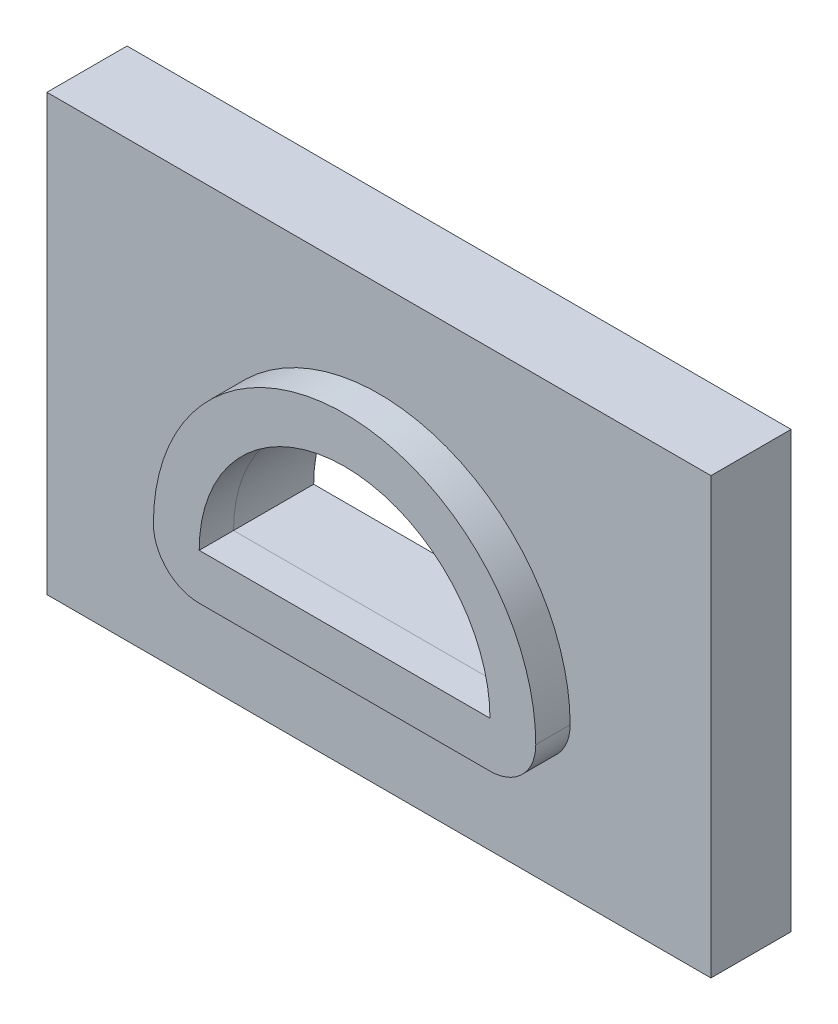
from build123d import *

# Parameters (mm, degrees)
CAP_ALIGNMENT_LIP_DEPTH = 1.5
SKETCH1_3_W             = 29
SKETCH1_3_H             = 19
CAP_BODY_DEPTH          = 3.5
LIP_CORNER_FILLET_R     = 2


with BuildPart() as part:
    # Sketch1 → cap alignment lip (new body)
    with BuildSketch(Plane.XY):
        with BuildLine():
            Line((10.5, -2), (10.5, 0))
            ThreePointArc((10.5, 0), (2.15, 8.35), (-6.2, 0))
            Line((-6.2, 0), (-6.2, -2))
            Line((-6.2, -2), (10.5, -2))
        make_face()
        with BuildLine():
            ThreePointArc((8.5, 0), (2.15, 6.35), (-4.2, 0))
            Line((-4.2, 0), (8.5, 0))
        make_face(mode=Mode.SUBTRACT)
    extrude(amount=CAP_ALIGNMENT_LIP_DEPTH)

    # lip corner fillet
    lip_corner_fillet_edges = [part.edges().sort_by_distance(p)[0] for p in [
        (-6.2, -2, 0.75),
        (10.5, -2, 0.75),
    ]]
    fillet(lip_corner_fillet_edges, radius=LIP_CORNER_FILLET_R - 0.0001)  # a hair under: the kernel refuses the full size


with BuildPart() as body_2:
    # Sketch1<3> → cap body (new body)
    # profile 1 of 2: a face of its own
    with BuildSketch(Plane.XY):
        with Locations((2.15, 3)):
            Rectangle(SKETCH1_3_W, SKETCH1_3_H)
        with BuildLine():
            ThreePointArc((10.5, 0), (2.15, 8.35), (-6.2, 0))
            Line((-6.2, 0), (-6.2, -2))
            Line((-6.2, -2), (10.5, -2))
            Line((10.5, -2), (10.5, 0))
        make_face(mode=Mode.SUBTRACT)
    # profile 2 of 2: a face of its own
    with BuildSketch(Plane.XY):
        with BuildLine():
            Line((10.5, -2), (10.5, 0))
            ThreePointArc((10.5, 0), (2.15, 8.35), (-6.2, 0))
            Line((-6.2, 0), (-6.2, -2))
            Line((-6.2, -2), (10.5, -2))
        make_face()
        with BuildLine():
            ThreePointArc((8.5, 0), (2.15, 6.35), (-4.2, 0))
            Line((-4.2, 0), (8.5, 0))
        make_face(mode=Mode.SUBTRACT)
    extrude(amount=-CAP_BODY_DEPTH)


solid = Compound([part.part, body_2.part])
